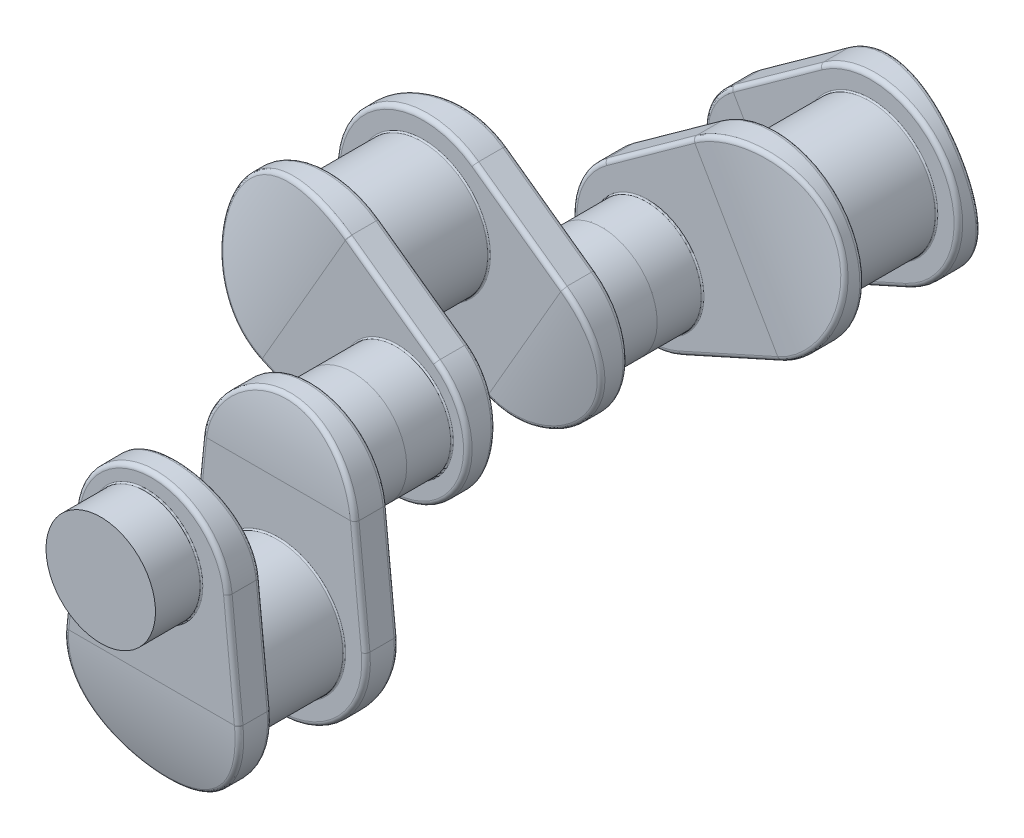
from build123d import *

# Parameters (mm, degrees)
SKETCH1_R               = 38.1
BOSS_EXTRUDE1_DEPTH     = 27.31
BOSS_EXTRUDE2_DEPTH     = 19
SKETCH4_R               = 31.75
BOSS_EXTRUDE3_DEPTH     = 26.67
CUT_EXTRUDE1_DEPTH      = 140.856794258
CUT_EXTRUDE1_DEPTH_BACK = 140.856794258
FILLET1_R               = 2.5
FILLET2_R               = 0.8
LPATTERN1_COUNT         = 3
LPATTERN1_PITCH         = 145.36
BODY_MOVE_COPY1_ANGLE   = 120
BODY_MOVE_COPY2_ANGLE   = 120


with BuildPart() as part:
    # Sketch1 → Boss-Extrude1 (new body)
    with BuildSketch(Plane.XY):
        Circle(SKETCH1_R)
    extrude(amount=BOSS_EXTRUDE1_DEPTH)

    # Sketch2 → Boss-Extrude2 (add)
    with BuildSketch(Plane.XY.offset(27.31)):
        with BuildLine():
            Line((-44.227191579, 67.945), (-50.545361805, 5.08))
            ThreePointArc((-50.545361805, 5.08), (0, -50.8), (50.545361805, 5.08))
            Line((50.545361805, 5.08), (44.227191579, 67.945))
            ThreePointArc((44.227191579, 67.945), (0, 107.95), (-44.227191579, 67.945))
        make_face()
    extrude(amount=BOSS_EXTRUDE2_DEPTH)

    # Sketch4 → Boss-Extrude3 (add)
    with BuildSketch(Plane.XY.offset(46.31)):
        with Locations(Location((-2.823529968, 65.945249576, 0), (0, 0, 180))):
            Circle(SKETCH4_R)
    extrude(amount=BOSS_EXTRUDE3_DEPTH)

    # Sketch5 → Cut-Extrude1 (cut, two sides: drawn at the far end of the back side and taken through both)
    with BuildSketch(Plane(origin=(0, 0, 0), x_dir=(0, 0, -1), z_dir=(1, 0, 0)).offset(-CUT_EXTRUDE1_DEPTH_BACK)):
        with BuildLine():
            Line((-46.31, 5.08), (-64.227029685, 5.08))
            Line((-64.227029685, 5.08), (-64.227029685, -50.8))
            Line((-64.227029685, -50.8), (-36.81, -50.8))
            ThreePointArc((-36.81, -50.8), (-43.91944182, -23.261121999), (-46.31, 5.08))
        make_face()
        with BuildLine():
            Line((-32.31, 107.95), (-32.31, 128.899397555))
            Line((-32.31, 128.899397555), (-11.553358594, 128.899397555))
            Line((-11.553358594, 128.899397555), (-11.553358594, 67.945))
            Line((-11.553358594, 67.945), (-27.31, 67.945))
            ThreePointArc((-27.31, 67.945), (-28.612788868, 88.097132687), (-32.31, 107.95))
        make_face()
    extrude(amount=CUT_EXTRUDE1_DEPTH + CUT_EXTRUDE1_DEPTH_BACK, mode=Mode.SUBTRACT)

    # Fillet1
    fillet1_edges = [part.edges().sort_by_distance(p)[0] for p in [
        (50.54699978, 5.063675864, 46.31),
        (37.651852459, -34.102463357, 41.708947132),
        (29.82084304, 96.462400097, 29.871687327),
        (0, -50.8, 27.31),
        (47.386276692, 36.5125, 27.31),
        (-47.386276692, 36.5125, 27.31),
        (-50.54699978, 5.063675864, 46.31),
        (47.386276692, 36.5125, 46.31),
        (0, 107.95, 46.31),
        (-47.386276692, 36.5125, 46.31),
    ]]
    fillet(fillet1_edges, radius=FILLET1_R)

    # Fillet2
    fillet2_edges = [part.edges().sort_by_distance(p)[0] for p in [
        (28.926470032, 65.945249576, 46.31),
        (-38.1, 0, 27.31),
    ]]
    fillet(fillet2_edges, radius=FILLET2_R)

    # Mirror5: part across plane


with BuildPart() as part_1:
    add(part.part)
    add(part.part.mirror(Plane.XY))


with BuildPart() as lpattern1_1:
    # LPattern1: pattern copy
    add(part_1.part.moved(Location(Vector(0, 0, -1) * (1 * LPATTERN1_PITCH))))


with BuildPart() as lpattern1_2:
    # LPattern1: pattern copy
    add(part_1.part.moved(Location(Vector(0, 0, -1) * (2 * LPATTERN1_PITCH))))


with BuildPart() as lpattern1_1_1:
    # Body-Move/Copy1: moved
    add(lpattern1_1.part.rotate(Axis((-2.823529968, 65.945249576, 0), (0, 0, -1)), BODY_MOVE_COPY1_ANGLE))


with BuildPart() as lpattern1_2_1:
    # Body-Move/Copy2: moved
    add(lpattern1_2.part.rotate(Axis((-2.823529968, 65.945249576, 0), (0, 0, 1)), BODY_MOVE_COPY2_ANGLE))


solid = Compound([part_1.part, lpattern1_1_1.part, lpattern1_2_1.part])
